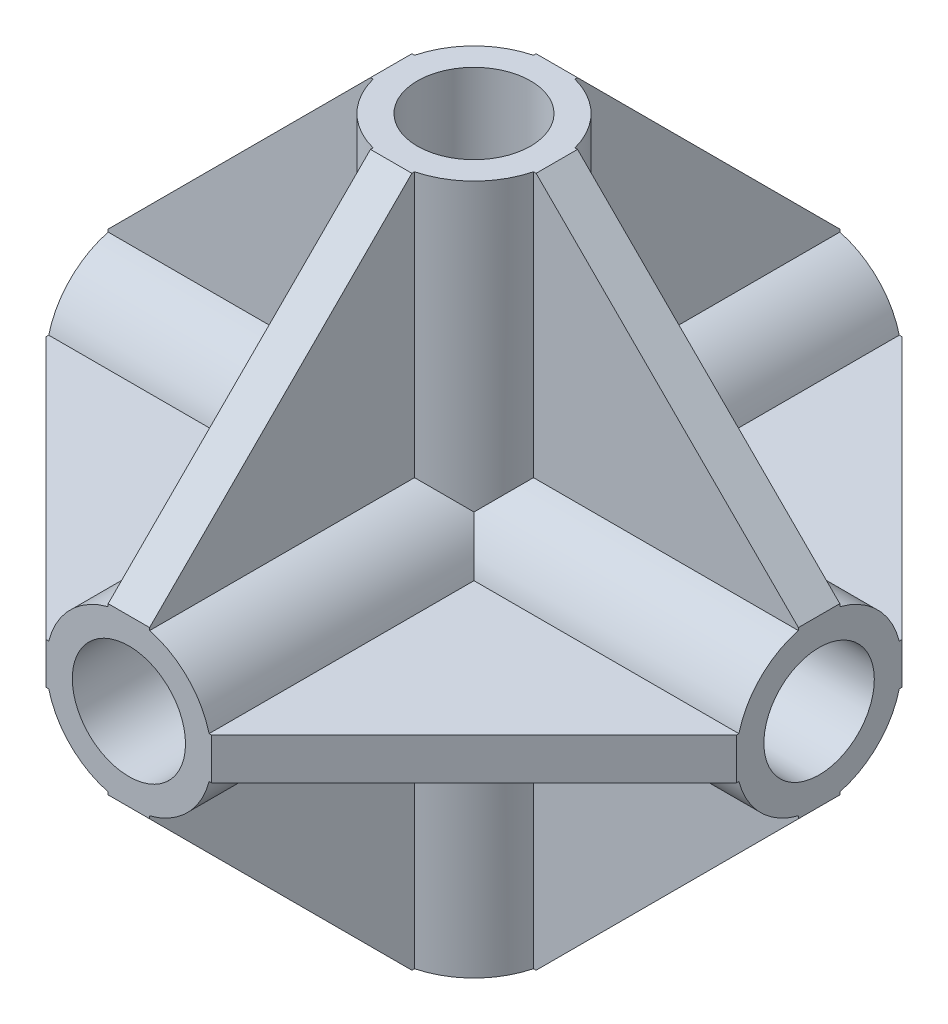
from build123d import *
from build123d.topology import SkipClean

# Parameters (mm, degrees)
SKETCH_1_R          = 6
SKETCH_1_R_2        = 4.1
EXTRUDE_1_DEPTH     = 25
SKETCH_2_R          = 6
SKETCH_2_R_2        = 4.1
EXTRUDE_2_DEPTH     = 25
SKETCH_3_R          = 6
SKETCH_3_R_2        = 4
EXTRUDE_3_DEPTH     = 25
SKETCH_4_R          = 4.1
CUT_EXTRUDE_1_DEPTH = 44
SKETCH_5_R          = 4
CUT_EXTRUDE_2_DEPTH = 44
SKETCH_6_R          = 4.1
CUT_EXTRUDE_3_DEPTH = 44
SKETCH_7_R          = 5.5
EXTRUDE_4_DEPTH     = 2
SKETCH_8_R          = 5.5
EXTRUDE_5_DEPTH     = 2
EXTRUDE_6_DEPTH     = 1.5
EXTRUDE_7_DEPTH     = 1.5
EXTRUDE_8_DEPTH     = 1.5
SKETCH_14_R         = 4.1
CUT_EXTRUDE_4_DEPTH = 86
SKETCH_15_R         = 4
CUT_EXTRUDE_5_DEPTH = 86
CUT_EXTRUDE_START   = -86
SKETCH_16_R         = 4.1
CUT_EXTRUDE_6_DEPTH = 86
EXTRUDE_10_DEPTH    = 2
EXTRUDE_11_DEPTH    = 2


with BuildPart() as part:
    # 草图1 → 凸台-拉伸1 (new, symmetric)
    with BuildSketch(Plane(origin=(0, 0, 0), x_dir=(1, 0, 0), z_dir=(0, 1, 0))):
        Circle(SKETCH_1_R)
        Circle(SKETCH_1_R_2, mode=Mode.SUBTRACT)
    extrude(amount=EXTRUDE_1_DEPTH, both=True)

    # 草图2 → 凸台-拉伸2 (add, symmetric)
    with BuildSketch(Plane.XY):
        Circle(SKETCH_2_R)
        Circle(SKETCH_2_R_2, mode=Mode.SUBTRACT)
    extrude(amount=EXTRUDE_2_DEPTH, both=True)

    # 草图3 → 凸台-拉伸3 (add, symmetric)
    with BuildSketch(Plane(origin=(0, 0, 0), x_dir=(0, 0, -1), z_dir=(1, 0, 0))):
        Circle(SKETCH_3_R)
        Circle(SKETCH_3_R_2, mode=Mode.SUBTRACT)
    extrude(amount=EXTRUDE_3_DEPTH, both=True)

    # 草图4 → 切除-拉伸1 (cut)
    with BuildSketch(Plane.XZ.offset(25)):
        Circle(SKETCH_4_R)
    extrude(amount=-CUT_EXTRUDE_1_DEPTH, mode=Mode.SUBTRACT)

    # 草图5 → 切除-拉伸2 (cut)
    with SkipClean():  # the faces are left unmerged after this step: merging them gives an invalid solid
        with BuildSketch(Plane.ZY.offset(25)):
            Circle(SKETCH_5_R)
        extrude(amount=-CUT_EXTRUDE_2_DEPTH, mode=Mode.SUBTRACT)
    add(part.part.scale(1), mode=Mode.REPLACE)  # the faces are merged on a copy

    # 草图6 → 切除-拉伸3 (cut)
    with BuildSketch(Plane(origin=(0, 0, -25), x_dir=(-1, 0, 0), z_dir=(0, 0, -1))):
        Circle(SKETCH_6_R)
    extrude(amount=-CUT_EXTRUDE_3_DEPTH, mode=Mode.SUBTRACT)

    # 草图7 → 凸台-拉伸4 (add)
    with BuildSketch(Plane(origin=(0, 6, 0), x_dir=(1, 0, 0), z_dir=(0, 1, 0))):
        Circle(SKETCH_7_R)
    extrude(amount=EXTRUDE_4_DEPTH)

    # 草图8 → 凸台-拉伸5 (add)
    with BuildSketch(Plane(origin=(6, 0, 0), x_dir=(0, 0, -1), z_dir=(1, 0, 0))):
        Circle(SKETCH_8_R)
    extrude(amount=EXTRUDE_5_DEPTH)

    # 草图11 → 凸台-拉伸6 (add, symmetric)
    with BuildSketch(Plane(origin=(0, 0, 0), x_dir=(0, 0, -1), z_dir=(1, 0, 0))):
        Polygon((-6, 25), (-25, 6), (-25, -6), (-6, -25), (6, -25), (25, -6), (25, 6), (6, 25), align=None)
    extrude(amount=EXTRUDE_6_DEPTH, both=True)

    # 草图12 → 凸台-拉伸7 (add, symmetric)
    with BuildSketch(Plane.XY):
        Polygon((6, 25), (25, 6), (25, -6), (6, -25), (-6, -25), (-25, -6), (-25, 6), (-6, 25), align=None)
    extrude(amount=EXTRUDE_7_DEPTH, both=True)

    # 草图13 → 凸台-拉伸8 (add, symmetric)
    with BuildSketch(Plane(origin=(0, 0, 0), x_dir=(1, 0, 0), z_dir=(0, 1, 0))):
        Polygon((6, 25), (25, 6), (25, -6), (6, -25), (-6, -25), (-25, -6), (-25, 6), (-6, 25), align=None)
    extrude(amount=EXTRUDE_8_DEPTH, both=True)

    # 草图14 → 切除-拉伸4 (cut)
    with BuildSketch(Plane.XZ.offset(25)):
        Circle(SKETCH_14_R)
    extrude(amount=-CUT_EXTRUDE_4_DEPTH, mode=Mode.SUBTRACT)

    # 草图15 → 切除-拉伸5 (cut)
    with SkipClean():  # the faces are left unmerged after this step: merging them gives an invalid solid
        with BuildSketch(Plane.ZY.offset(25)):
            Circle(SKETCH_15_R)
        extrude(amount=-CUT_EXTRUDE_5_DEPTH, mode=Mode.SUBTRACT)
    add(part.part.scale(1), mode=Mode.REPLACE)  # the faces are merged on a copy

    # 草图16 → 切除-拉伸6 (cut)
    with BuildSketch(Plane.XY.offset(25).offset(CUT_EXTRUDE_START)):
        Circle(SKETCH_16_R)
    extrude(amount=CUT_EXTRUDE_6_DEPTH, mode=Mode.SUBTRACT)

    # 草图17 → 凸台-拉伸10 (add)
    with BuildSketch(Plane(origin=(6, 0, 0), x_dir=(0, 0, -1), z_dir=(1, 0, 0))):
        Polygon((-6, 1.5), (-1.5, 1.5), (-1.5, 6), (1.5, 6), (1.5, 1.5), (6, 1.5), (6, -1.5), (1.5, -1.5), (1.5, -6), (-1.5, -6), (-1.5, -1.5), (-6, -1.5), align=None)
    extrude(amount=EXTRUDE_10_DEPTH)

    # 草图18 → 凸台-拉伸11 (add)
    with BuildSketch(Plane(origin=(0, 6, 0), x_dir=(1, 0, 0), z_dir=(0, 1, 0))):
        Polygon((-6, 1.5), (-1.5, 1.5), (-1.5, 6), (1.5, 6), (1.5, 1.5), (6, 1.5), (6, -1.5), (1.5, -1.5), (1.5, -6), (-1.5, -6), (-1.5, -1.5), (-6, -1.5), align=None)
    extrude(amount=EXTRUDE_11_DEPTH)


solid = part.part
